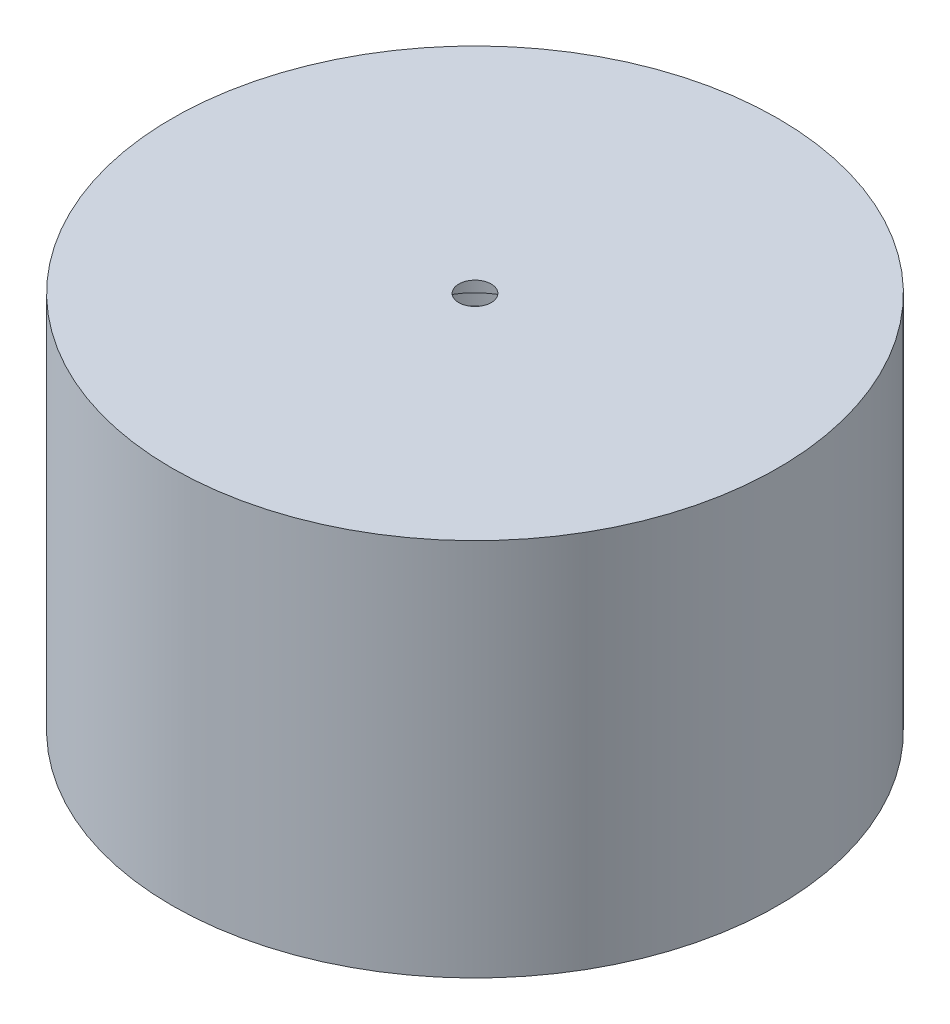
from build123d import *


with BuildPart() as part:
    # Эскиз1 → Повернуть1 (revolve)
    with BuildSketch(Plane.XY):
        with BuildLine():
            Line((17, 27), (17, 25.8))
            Line((17, 25.8), (30, 25.8))
            Line((30, 25.8), (30, 23.3))
            Line((30, 23.3), (28.4, 23.3))
            Line((28.4, 23.3), (28.4, 15.3))
            Line((28.4, 15.3), (37.427682956, 15.3))
            Line((37.427682956, 15.3), (37.427682956, 62.097891733))
            Line((37.427682956, 62.097891733), (2, 62.097891733))
            Line((2, 62.097891733), (8, 58.633790118))
            Line((8, 58.633790118), (8, 56.5))
            Line((8, 56.5), (9.518118568, 56.5))
            Line((9.518118568, 56.5), (9.518118568, 54))
            Line((9.518118568, 54), (8, 54))
            Line((8, 54), (8, 52))
            Line((8, 52), (12, 47))
            Line((12, 47), (12, 45))
            Line((12, 45), (13.901332363, 45))
            Line((13.901332363, 45), (13.901332363, 42.5))
            Line((13.901332363, 42.5), (12, 42.5))
            Line((12, 42.5), (12, 41))
            ThreePointArc((12, 41), (13.5, 39.5), (12, 38))
            Line((12, 38), (12, 36.5))
            Line((12, 36.5), (13.901332363, 36.5))
            Line((13.901332363, 36.5), (13.901332363, 34))
            Line((13.901332363, 34), (12, 34))
            Line((12, 34), (12, 32))
            Line((12, 32), (17, 27))
        make_face()
    revolve(axis=Axis((0, 0, 0), (0, 1, 0)))


solid = part.part
